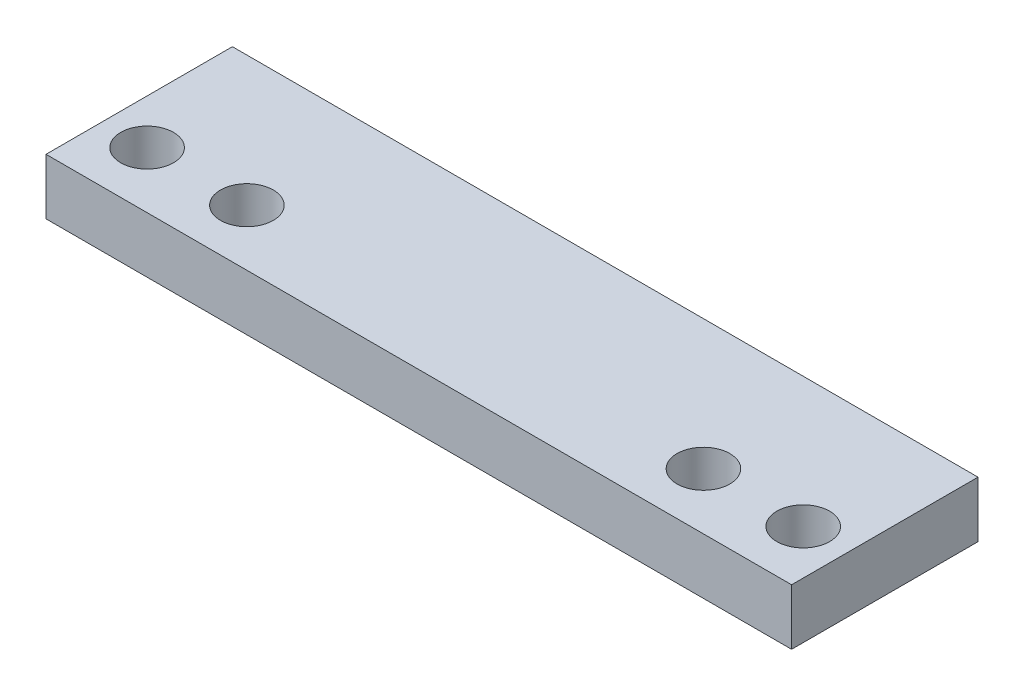
from build123d import *

# Parameters (mm, degrees)
SKETCH1_W           = 63.5
SKETCH1_H           = 15.875
SKETCH1_R           = 2.2479
BOSS_EXTRUDE1_DEPTH = 2.38125


with BuildPart() as part:
    # Sketch1 → Boss-Extrude1 (new, symmetric)
    with BuildSketch(Plane(origin=(0, 0, 0), x_dir=(1, 0, 0), z_dir=(0, 1, 0))):
        Rectangle(SKETCH1_W, SKETCH1_H)
        with Locations((-27.94, -3.1369)):
            Circle(SKETCH1_R, mode=Mode.SUBTRACT)
        with Locations((-19.44116, -3.1369)):
            Circle(SKETCH1_R, mode=Mode.SUBTRACT)
        with Locations((27.94, -3.1369)):
            Circle(SKETCH1_R, mode=Mode.SUBTRACT)
        with Locations((19.44116, -3.1369)):
            Circle(SKETCH1_R, mode=Mode.SUBTRACT)
    extrude(amount=BOSS_EXTRUDE1_DEPTH, both=True)


solid = part.part
